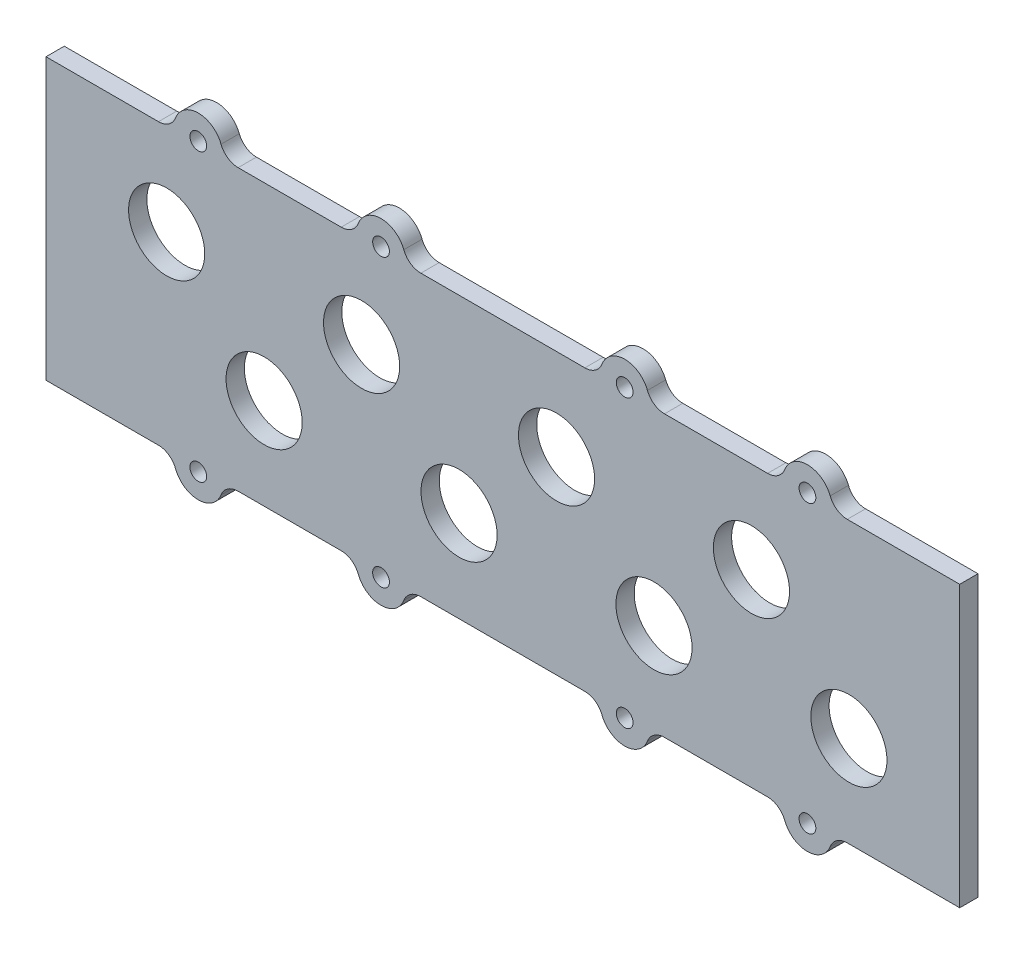
from build123d import *

# Parameters (mm, degrees)
SKETCH1_R           = 1.375
SKETCH1_R_2         = 6.25
BOSS_EXTRUDE1_DEPTH = 3


with BuildPart() as part:
    # Sketch1 → Boss-Extrude1 (new body)
    with BuildSketch(Plane.XY):
        with BuildLine():
            Line((-75, 23), (-75, -23))
            Line((-75, -23), (-56.538348415, -23))
            ThreePointArc((-56.538348415, -23), (-54.837508287, -23.528736587), (-53.736199094, -24.928571429))
            ThreePointArc((-53.736199094, -24.928571429), (-50, -27.5), (-46.263800906, -24.928571429))
            ThreePointArc((-46.263800906, -24.928571429), (-45.162491713, -23.528736587), (-43.461651585, -23))
            Line((-43.461651585, -23), (-26.538348415, -23))
            ThreePointArc((-26.538348415, -23), (-24.837508287, -23.528736587), (-23.736199094, -24.928571429))
            ThreePointArc((-23.736199094, -24.928571429), (-20, -27.5), (-16.263800906, -24.928571429))
            ThreePointArc((-16.263800906, -24.928571429), (-15.162491713, -23.528736587), (-13.461651585, -23))
            Line((-13.461651585, -23), (13.461651585, -23))
            ThreePointArc((13.461651585, -23), (15.162491713, -23.528736587), (16.263800906, -24.928571429))
            ThreePointArc((16.263800906, -24.928571429), (20, -27.5), (23.736199094, -24.928571429))
            ThreePointArc((23.736199094, -24.928571429), (24.837508287, -23.528736587), (26.538348415, -23))
            Line((26.538348415, -23), (43.461651585, -23))
            ThreePointArc((43.461651585, -23), (45.162491713, -23.528736587), (46.263800906, -24.928571429))
            ThreePointArc((46.263800906, -24.928571429), (50, -27.5), (53.736199094, -24.928571429))
            ThreePointArc((53.736199094, -24.928571429), (54.837508287, -23.528736587), (56.538348415, -23))
            Line((56.538348415, -23), (75, -23))
            Line((75, -23), (75, 23))
            Line((75, 23), (56.538348415, 23))
            ThreePointArc((56.538348415, 23), (54.837508287, 23.528736587), (53.736199094, 24.928571429))
            ThreePointArc((53.736199094, 24.928571429), (50, 27.5), (46.263800906, 24.928571429))
            ThreePointArc((46.263800906, 24.928571429), (45.162491713, 23.528736587), (43.461651585, 23))
            Line((43.461651585, 23), (26.538348415, 23))
            ThreePointArc((26.538348415, 23), (24.837508287, 23.528736587), (23.736199094, 24.928571429))
            ThreePointArc((23.736199094, 24.928571429), (20, 27.5), (16.263800906, 24.928571429))
            ThreePointArc((16.263800906, 24.928571429), (15.162491713, 23.528736587), (13.461651585, 23))
            Line((13.461651585, 23), (-13.461651585, 23))
            ThreePointArc((-13.461651585, 23), (-15.162491713, 23.528736587), (-16.263800906, 24.928571429))
            ThreePointArc((-16.263800906, 24.928571429), (-20, 27.5), (-23.736199094, 24.928571429))
            ThreePointArc((-23.736199094, 24.928571429), (-24.837508287, 23.528736587), (-26.538348415, 23))
            Line((-26.538348415, 23), (-43.461651585, 23))
            ThreePointArc((-43.461651585, 23), (-45.162491713, 23.528736587), (-46.263800906, 24.928571429))
            ThreePointArc((-46.263800906, 24.928571429), (-50, 27.5), (-53.736199094, 24.928571429))
            ThreePointArc((-53.736199094, 24.928571429), (-54.837508287, 23.528736587), (-56.538348415, 23))
            Line((-56.538348415, 23), (-75, 23))
        make_face()
        with Locations((-50, -23.5)):
            Circle(SKETCH1_R, mode=Mode.SUBTRACT)
        with Locations((-20, -23.5)):
            Circle(SKETCH1_R, mode=Mode.SUBTRACT)
        with Locations((20, -23.5)):
            Circle(SKETCH1_R, mode=Mode.SUBTRACT)
        with Locations((50, -23.5)):
            Circle(SKETCH1_R, mode=Mode.SUBTRACT)
        with Locations((50, 23.5)):
            Circle(SKETCH1_R, mode=Mode.SUBTRACT)
        with Locations((20, 23.5)):
            Circle(SKETCH1_R, mode=Mode.SUBTRACT)
        with Locations((-20, 23.5)):
            Circle(SKETCH1_R, mode=Mode.SUBTRACT)
        with Locations((-50, 23.5)):
            Circle(SKETCH1_R, mode=Mode.SUBTRACT)
        with Locations((-55.192693601, 8)):
            Circle(SKETCH1_R_2, mode=Mode.SUBTRACT)
        with Locations((-23.192693601, 8)):
            Circle(SKETCH1_R_2, mode=Mode.SUBTRACT)
        with Locations((8.807306399, 8)):
            Circle(SKETCH1_R_2, mode=Mode.SUBTRACT)
        with Locations((40.807306399, 8)):
            Circle(SKETCH1_R_2, mode=Mode.SUBTRACT)
        with Locations((-39.192693601, -8)):
            Circle(SKETCH1_R_2, mode=Mode.SUBTRACT)
        with Locations((-7.192693601, -8)):
            Circle(SKETCH1_R_2, mode=Mode.SUBTRACT)
        with Locations((24.807306399, -8)):
            Circle(SKETCH1_R_2, mode=Mode.SUBTRACT)
        with Locations((56.807306399, -8)):
            Circle(SKETCH1_R_2, mode=Mode.SUBTRACT)
    extrude(amount=BOSS_EXTRUDE1_DEPTH)


solid = part.part
